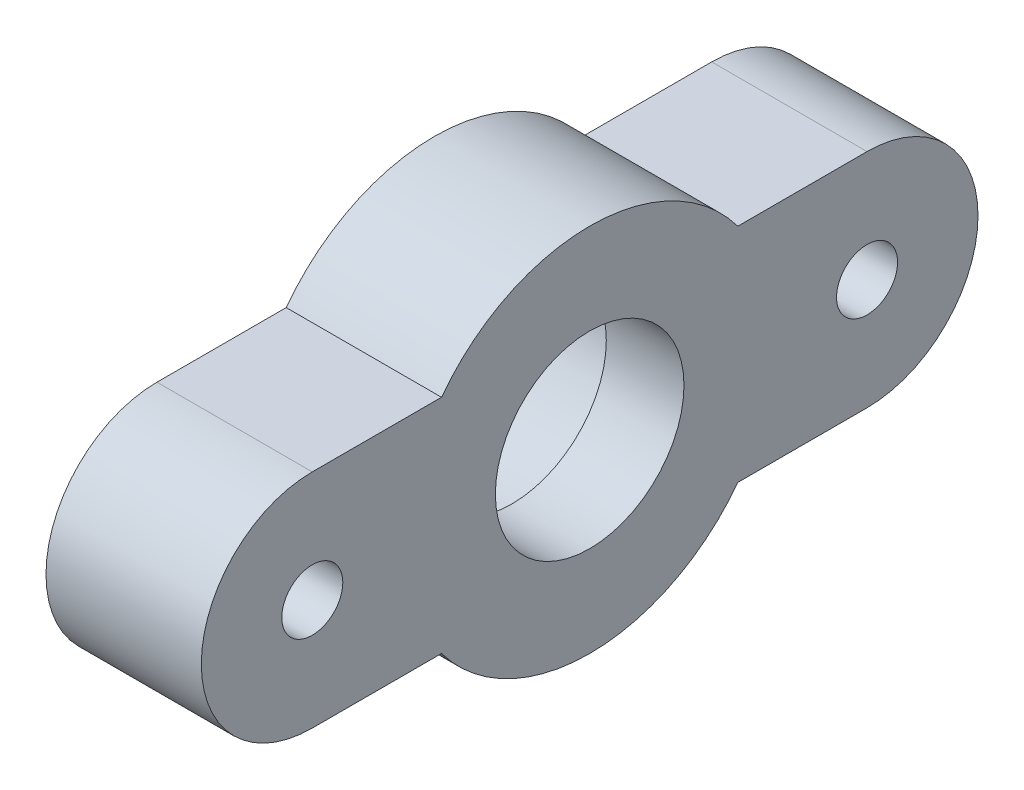
from build123d import *

# Parameters (mm, degrees)
AUFSATZ_LINEAR_START             = -14
AUFSATZ_LINEAR_AUSTRAGEN1_DEPTH  = 14
F_5_5_5_5_DURCHMESSER_BOHRUNG1_D = 5.5


with BuildPart() as part:
    # Skizze4 → Rotation1 (revolve)
    with BuildSketch(Plane.XY):
        Polygon((0, 11), (7, 11), (7, 8.5), (14, 8.5), (14, 16.683058648), (0, 16.683058648), align=None)
    revolve(axis=Axis((0, 0, 0), (1, 0, 0)))

    # Skizze5 → Aufsatz-Linear austragen1 (add)
    with BuildSketch(Plane(origin=(14, 0, 0), x_dir=(0, 0, -1), z_dir=(1, 0, 0)).offset(AUFSATZ_LINEAR_START)):
        with BuildLine():
            Line((-25, 10), (-13.35381765, 10))
            ThreePointArc((-13.35381765, 10), (-16.683058648, 0), (-13.35381765, -10))
            Line((-13.35381765, -10), (-25, -10))
            ThreePointArc((-25, -10), (-35, 0), (-25, 10))
        make_face()
    aufsatz_linear_austragen1 = extrude(amount=AUFSATZ_LINEAR_AUSTRAGEN1_DEPTH)

    # Ø5.5 (5.5) Durchmesser Bohrung1 (through all)
    with Locations(Plane(origin=(14, 0, 0), x_dir=(0, 0, -1), z_dir=(1, 0, 0))):
        with Locations((-25, 0)):
            f_5_5_5_5_durchmesser_bohrung1 = Hole(F_5_5_5_5_DURCHMESSER_BOHRUNG1_D / 2)

    # Spiegeln1: Aufsatz-Linear austragen1, Ø5.5 (5.5) Durchmesser Bohrung1 across plane
    add(aufsatz_linear_austragen1.mirror(Plane.XY))
    add(f_5_5_5_5_durchmesser_bohrung1.mirror(Plane.XY), mode=Mode.SUBTRACT)


solid = part.part
